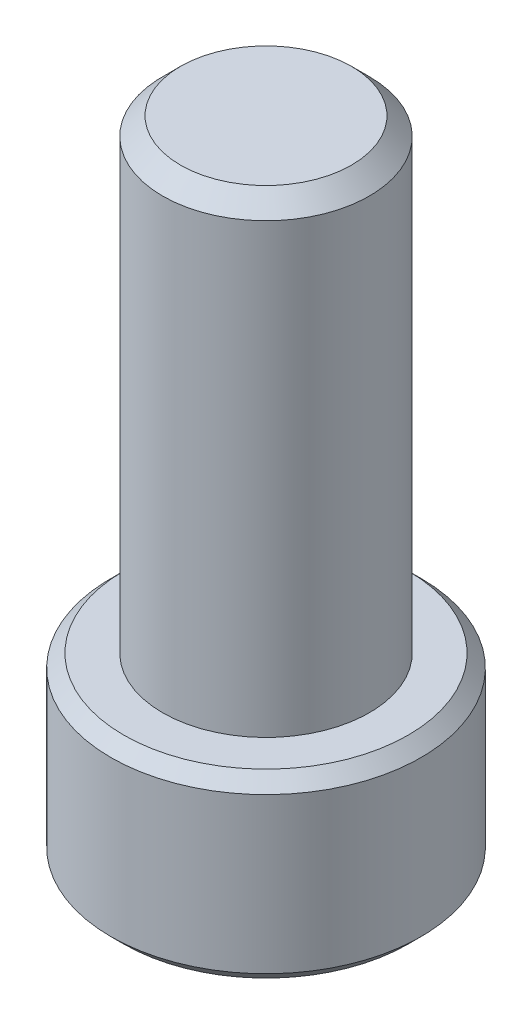
from build123d import *

# Parameters (mm, degrees)
SKETCH1_R               = 6
BOSS_EXTRUDE1_DEPTH     = 25
CHAMFER1_SIZE           = 0.5
CUT_EXTRUDE1_DEPTH      = 27.400757565
CUT_EXTRUDE1_DEPTH_BACK = 2.5
CHAMFER2_SIZE           = 0.25


# Read off the part's stored shape, not the designer's step: M8x1.25 Machine Threads Stud2
with BuildPart() as part:
    # Sketch1 → Boss-Extrude1 (new body)
    with BuildSketch(Plane(origin=(0, 0, 0), x_dir=(1, 0, 0), z_dir=(0, 1, 0))):
        with Locations(Location((0, 0, 0), (0, 0, 270))):
            Circle(SKETCH1_R)
    extrude(amount=BOSS_EXTRUDE1_DEPTH)

    # M8x1.25 Machine Threads Stud2 outline → M8x1.25 Machine Threads Stud2 (revolve, cut)
    with BuildSketch(Plane.XY):
        Polygon((6, 25), (3.3095, 25), (4, 24.3095), (4, 7), (6, 7), align=None)
    revolve(axis=Axis((0, 0, 0), (0, 1, 0)), mode=Mode.SUBTRACT)

    # Chamfer1
    chamfer1_edges = [part.edges().sort_by_distance(p)[0] for p in [
        (0, 0, -6),
        (0, 7, -6),
    ]]
    chamfer(chamfer1_edges, length=CHAMFER1_SIZE)

    # Sketch6 → Cut-Extrude1 (cut, two sides: drawn at the far end of the back side and taken through both)
    with BuildSketch(Plane.XZ.offset(-CUT_EXTRUDE1_DEPTH_BACK)):
        Polygon((0, -3), (2.598076211, -1.5), (2.598076211, 1.5), (0, 3), (-2.598076211, 1.5), (-2.598076211, -1.5), align=None)
    extrude(amount=CUT_EXTRUDE1_DEPTH + CUT_EXTRUDE1_DEPTH_BACK, mode=Mode.SUBTRACT)

    # Chamfer2
    chamfer2_edges = [part.edges().sort_by_distance(p)[0] for p in [
        (-2.598076211, 0, 0),
        (-1.299038106, 0, 2.25),
        (1.299038106, 0, 2.25),
        (2.598076211, 0, 0),
        (1.299038106, 0, -2.25),
        (-1.299038106, 0, -2.25),
        (-1.299038106, 2.5, -2.25),
        (1.299038106, 2.5, -2.25),
        (2.598076211, 2.5, 0),
        (1.299038106, 2.5, 2.25),
        (-1.299038106, 2.5, 2.25),
        (-2.598076211, 2.5, 0),
    ]]
    chamfer(chamfer2_edges, length=CHAMFER2_SIZE)


solid = part.part
